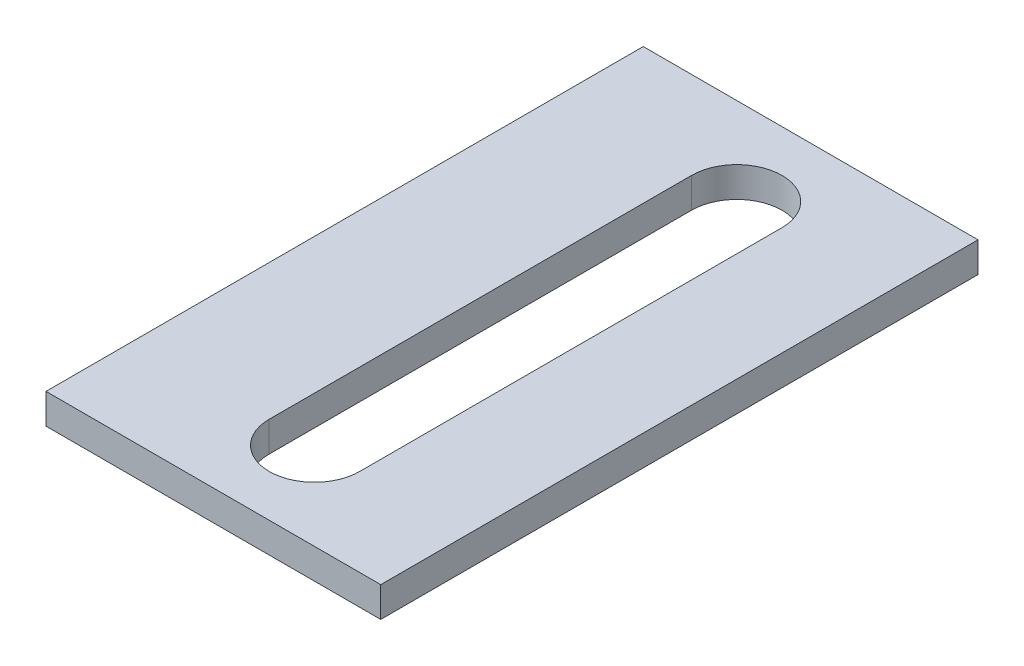
from build123d import *

# Parameters (mm, degrees)
SKETCH1_W               = 13.8
SKETCH1_H               = 8.8
BOSS_EXTRUDE1_DEPTH     = 3
SKETCH2_W               = 2
SKETCH2_H               = 35
BOSS_EXTRUDE2_DEPTH     = 3
SKETCH3_W               = 1.2
SKETCH3_H               = 6
BOSS_EXTRUDE3_DEPTH     = 7
FILLET3_R               = 10
SKETCH5_W               = 15
SKETCH5_H               = 13.8
BOSS_EXTRUDE4_DEPTH     = 4
SKETCH6_R               = 1.5
CUT_EXTRUDE4_DEPTH      = 38.968539608
BOSS_EXTRUDE5_DEPTH     = 2
CHAMFER2_SIZE           = 3
BOSS_EXTRUDE7_DEPTH     = 1.2
SKETCH12_W              = 15
SKETCH12_H              = 4
BOSS_EXTRUDE8_DEPTH     = 3
SKETCH13_W              = 15
SKETCH13_H              = 4
BOSS_EXTRUDE9_DEPTH     = 3
CUT_EXTRUDE7_DEPTH      = 43.28486727
CUT_EXTRUDE7_DEPTH_BACK = 43.28486727
CUT_EXTRUDE8_DEPTH      = 43.28486727
CUT_EXTRUDE8_DEPTH_BACK = 43.28486727
SKETCH15_W              = 0.807911756
SKETCH15_H              = 0.64
CUT_EXTRUDE9_DEPTH      = 41.244591358
CUT_EXTRUDE9_DEPTH_BACK = 41.244591358
SKETCH16_W              = 0.64
SKETCH16_H              = 0.6
CHAMFER3_SIZE           = 1
SKETCH18_W              = 20.701942652
SKETCH18_H              = 41.728044518
CUT_EXTRUDE10_DEPTH     = 36
SKETCH19_W              = 11.097134513
SKETCH19_H              = 20.928514419
CUT_EXTRUDE11_DEPTH     = 3


# Some blends are built 0.0001 mm under size
with BuildPart() as part:
    # Sketch1 → Boss-Extrude1 (new body)
    with BuildSketch(Plane(origin=(0, 0, 0), x_dir=(0, 0, -1), z_dir=(1, 0, 0))):
        Rectangle(SKETCH1_W, SKETCH1_H)
    extrude(amount=BOSS_EXTRUDE1_DEPTH)

    # Sketch2 → Boss-Extrude2 (add)
    with BuildSketch(Plane(origin=(3, 0, 0), x_dir=(0, 0, -1), z_dir=(1, 0, 0))):
        with Locations((0, -13.1)):
            Rectangle(SKETCH2_W, SKETCH2_H)
    extrude(amount=BOSS_EXTRUDE2_DEPTH)

    # Sketch3 → Boss-Extrude3 (add)
    with BuildSketch(Plane(origin=(6, 0, 0), x_dir=(0, 0, -1), z_dir=(1, 0, 0))):
        with Locations((0, -27.6)):
            Rectangle(SKETCH3_W, SKETCH3_H)
    extrude(amount=BOSS_EXTRUDE3_DEPTH)

    # Fillet3
    # the kernel refuses this fillet: 10 mm, written as the material it adds along each edge
    with BuildSketch(Plane(origin=(3, -4.4, 1), x_dir=(-1, 0, 0), z_dir=(0, 0, -1))) as fillet3_piece_1:
        with BuildLine():
            CenterArc((10, -7.141428429), FILLET3_R, 134.427004001, 45.572995999)
            Line((0, -7.141428429), (0, 0))
            Line((0, 0), (3, 0))
        make_face()
    extrude(amount=2)

    # Sketch5 → Boss-Extrude4 (add)
    with BuildSketch(Plane(origin=(0, 4.4, 0), x_dir=(1, 0, 0), z_dir=(0, 1, 0))):
        with Locations((-4.5, 0)):
            Rectangle(SKETCH5_W, SKETCH5_H)
    extrude(amount=BOSS_EXTRUDE4_DEPTH)

    # Sketch6 → Cut-Extrude4 (cut, through all)
    with BuildSketch(Plane.XZ.offset(-4.4)):
        with Locations(Location((-6, 3, 0), (0, 0, 270))):
            Circle(SKETCH6_R)
        with Locations(Location((-6, -3, 0), (0, 0, 270))):
            Circle(SKETCH6_R)
    extrude(amount=-CUT_EXTRUDE4_DEPTH, mode=Mode.SUBTRACT)

    # Sketch8 → Boss-Extrude5 (add)
    with BuildSketch(Plane(origin=(0, 0, -1), x_dir=(-1, 0, 0), z_dir=(0, 0, -1))):
        Polygon((-3, -18.758153574), (0, -4.4), (-3, -4.4), align=None)
    extrude(amount=-BOSS_EXTRUDE5_DEPTH)

    # Chamfer2
    chamfer2_edges = [part.edges().sort_by_distance(p)[0] for p in [
        (3, 4.4, 0),
    ]]
    chamfer(chamfer2_edges, length=CHAMFER2_SIZE - 0.0001)  # a hair under: the kernel refuses the full size

    # Sketch11 → Boss-Extrude7 (add)
    with BuildSketch(Plane(origin=(0, 0, -0.6), x_dir=(-1, 0, 0), z_dir=(0, 0, -1))):
        Polygon((-6, -24.6), (-13, -24.6), (-6, 1.742521041), align=None)
    extrude(amount=-BOSS_EXTRUDE7_DEPTH)

    # Sketch12 → Boss-Extrude8 (add)
    with BuildSketch(Plane(origin=(0, 0, -6.9), x_dir=(-1, 0, 0), z_dir=(0, 0, -1))):
        with Locations((4.5, 6.4)):
            Rectangle(SKETCH12_W, SKETCH12_H)
    extrude(amount=BOSS_EXTRUDE8_DEPTH)

    # Sketch13 → Boss-Extrude9 (add)
    with BuildSketch(Plane.XY.offset(6.9)):
        with Locations((-4.5, 6.4)):
            Rectangle(SKETCH13_W, SKETCH13_H)
    extrude(amount=BOSS_EXTRUDE9_DEPTH)

    # Sketch14 → Cut-Extrude7 (cut, two sides: drawn at the far end of the back side and taken through both)
    with BuildSketch(Plane(origin=(0, 8.4, 0), x_dir=(1, 0, 0), z_dir=(0, 1, 0)).offset(-CUT_EXTRUDE7_DEPTH_BACK)):
        with BuildLine():
            Line((-7.5, 7), (-7.5, -7))
            ThreePointArc((-7.5, -7), (-6, -8.5), (-4.5, -7))
            Line((-4.5, -7), (-4.5, 7))
            ThreePointArc((-4.5, 7), (-6, 8.5), (-7.5, 7))
        make_face()
    extrude(amount=CUT_EXTRUDE7_DEPTH + CUT_EXTRUDE7_DEPTH_BACK, mode=Mode.SUBTRACT)

    # Sketch15 → Cut-Extrude8 (cut, two sides: drawn at the far end of the back side and taken through both)
    with BuildSketch(Plane.XZ.offset(30.6).offset(-CUT_EXTRUDE8_DEPTH_BACK)):
        with Locations((12.596044122, 0)):
            Rectangle(SKETCH15_W, SKETCH15_H)
    extrude(amount=CUT_EXTRUDE8_DEPTH + CUT_EXTRUDE8_DEPTH_BACK, mode=Mode.SUBTRACT)

    # Sketch16 → Cut-Extrude9 (cut, two sides: drawn at the far end of the back side and taken through both)
    with BuildSketch(Plane(origin=(12.192088244, 0, 0), x_dir=(0, 0, -1), z_dir=(1, 0, 0)).offset(-CUT_EXTRUDE9_DEPTH_BACK)):
        with Locations((0, -30.3)):
            Rectangle(SKETCH16_W, SKETCH16_H)
    extrude(amount=CUT_EXTRUDE9_DEPTH + CUT_EXTRUDE9_DEPTH_BACK, mode=Mode.SUBTRACT)

    # Chamfer3
    chamfer3_edges = [part.edges().sort_by_distance(p)[0] for p in [
        (12.192088244, -30, 0),
    ]]
    chamfer(chamfer3_edges, length=CHAMFER3_SIZE)

    # Sketch18 → Cut-Extrude10 (cut)
    with BuildSketch(Plane.XY.offset(9.9)):
        with Locations((9.448105839, -12.464022259)):
            Rectangle(SKETCH18_W, SKETCH18_H)
    extrude(amount=-CUT_EXTRUDE10_DEPTH, mode=Mode.SUBTRACT)

    # Sketch19 → Cut-Extrude11 (cut)
    with BuildSketch(Plane.XZ.offset(-4.4)):
        with Locations((-6.451432743, 0.56425721)):
            Rectangle(SKETCH19_W, SKETCH19_H)
    extrude(amount=-CUT_EXTRUDE11_DEPTH, mode=Mode.SUBTRACT)


solid = part.part
